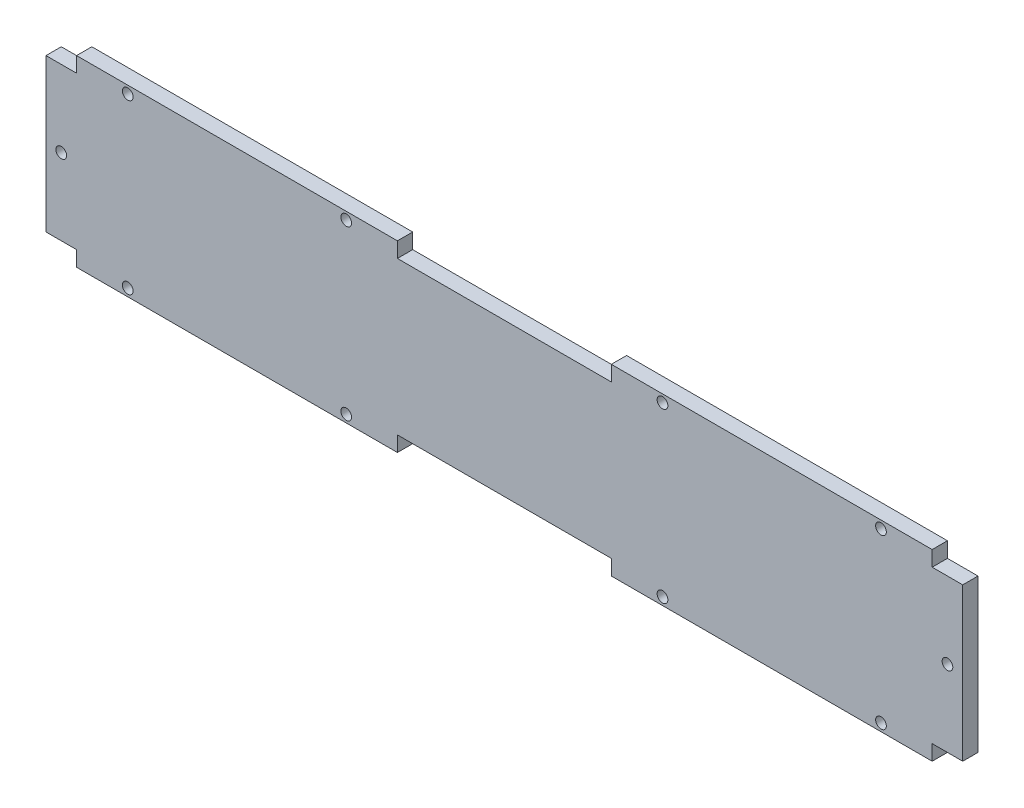
from build123d import *

# Parameters (mm, degrees)
BOSS_EXTRUDE1_DEPTH = 5
SKETCH2_R           = 1.75
CUT_EXTRUDE1_DEPTH  = 5
SKETCH3_R           = 1.75
CUT_EXTRUDE2_DEPTH  = 10


with BuildPart() as part:
    # Sketch1 → Boss-Extrude1 (new body)
    with BuildSketch(Plane.XY):
        Polygon((-140, 0), (-140, -5), (-35, -5), (-35, 0), (35, 0), (35, -5), (140, -5), (140, 0), (150, 0), (150, 50), (140, 50), (140, 55), (35, 55), (35, 50), (-35, 50), (-35, 55), (-140, 55), (-140, 50), (-150, 50), (-150, 0), align=None)
    extrude(amount=BOSS_EXTRUDE1_DEPTH)

    # Sketch2 → Cut-Extrude1 (cut)
    with BuildSketch(Plane.XY.offset(5)):
        with Locations((-123.25, -2.5)):
            Circle(SKETCH2_R)
        with Locations((-51.75, -2.5)):
            Circle(SKETCH2_R)
        with Locations((51.75, -2.5)):
            Circle(SKETCH2_R)
        with Locations((123.25, -2.5)):
            Circle(SKETCH2_R)
        with Locations((123.25, 52.5)):
            Circle(SKETCH2_R)
        with Locations((51.75, 52.5)):
            Circle(SKETCH2_R)
        with Locations((-51.75, 52.5)):
            Circle(SKETCH2_R)
        with Locations((-123.25, 52.5)):
            Circle(SKETCH2_R)
    extrude(amount=-CUT_EXTRUDE1_DEPTH, mode=Mode.SUBTRACT)

    # Sketch3 → Cut-Extrude2 (cut)
    with BuildSketch(Plane.XY.offset(5)):
        with Locations((-145, 25)):
            Circle(SKETCH3_R)
        with Locations((145, 25)):
            Circle(SKETCH3_R)
    extrude(amount=-CUT_EXTRUDE2_DEPTH, mode=Mode.SUBTRACT)


solid = part.part
